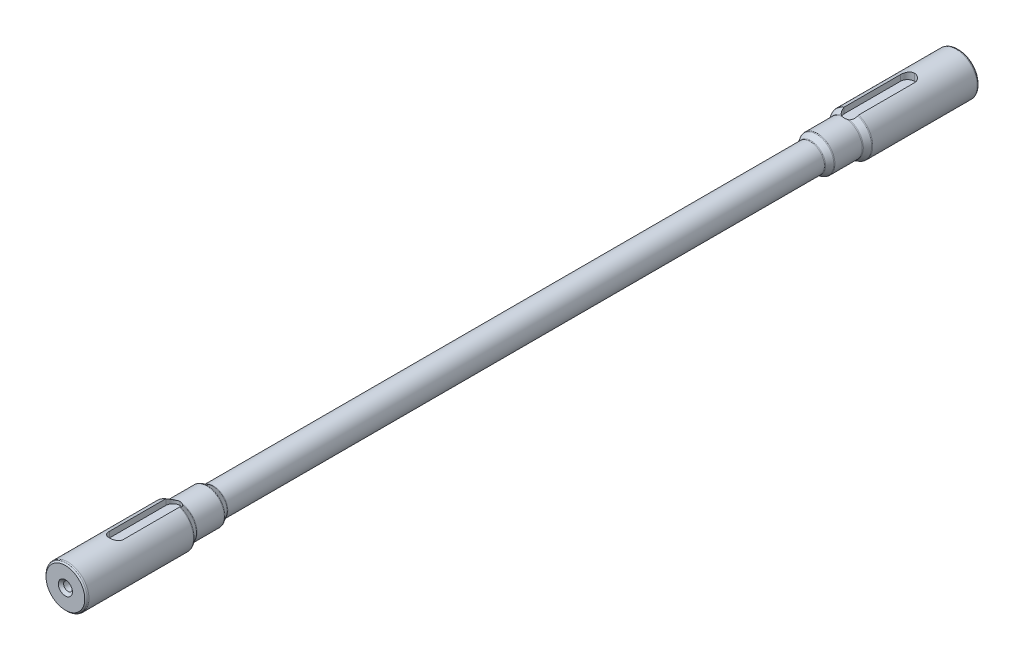
from build123d import *

# Parameters (mm, degrees)
SKETCH1_R                   = 12
BOSS_EXTRUDE1_DEPTH         = 253.5
CHAMFER1_SIZE               = 1
FILLET1_R                   = 1
SKETCH3_W                   = 40
SKETCH3_H                   = 8
CUT_EXTRUDE1_DEPTH          = 4
FILLET2_R                   = 4
M6_TAPPED_HOLE1_D           = 5
M6_TAPPED_HOLE1_DEPTH       = 17
M6_TAPPED_HOLE1_CSINK_D     = 8
M6_TAPPED_HOLE1_CSINK_ANGLE = 90
M6_TAPPED_HOLE1_TIP         = 1.502151548
M6_TAPPED_HOLE2_D           = 5
M6_TAPPED_HOLE2_DEPTH       = 17
M6_TAPPED_HOLE2_CSINK_D     = 8
M6_TAPPED_HOLE2_CSINK_ANGLE = 90
M6_TAPPED_HOLE2_TIP         = 1.502151548


with BuildPart() as part:
    # Sketch1 → Boss-Extrude1 (new, symmetric)
    with BuildSketch(Plane.XY):
        Circle(SKETCH1_R)
    extrude(amount=BOSS_EXTRUDE1_DEPTH, both=True)

    # Sketch2 → Cut-Revolve1 (revolve, cut)
    with BuildSketch(Plane(origin=(0, 0, 0), x_dir=(1, 0, 0), z_dir=(0, 1, 0)), mode=Mode.PRIVATE) as cut_revolve1_sk:
        Polygon((-10, 173.035898385), (-8, 169.57179677), (-8, -169.57179677), (-10, -173.035898385), (-10, -189.035898385), (-12, -192.5), (-12, -176.5), (-12, 176.5), (-12, 192.5), (-10, 189.035898385), align=None)
    revolve(cut_revolve1_sk.sketch.rotate(Axis((0, 0, 0), (0, 0, -1)), 180), axis=Axis((0, 0, 0), (0, 0, -1)), mode=Mode.SUBTRACT)

    # Chamfer1
    chamfer1_edges = [part.edges().sort_by_distance(p)[0] for p in [
        (-12, 0, -253.5),
        (-12, 0, 253.5),
    ]]
    chamfer(chamfer1_edges, length=CHAMFER1_SIZE)

    # Fillet1
    fillet1_edges = [part.edges().sort_by_distance(p)[0] for p in [
        (-12, 0, 252.5),
        (-12, 0, -252.5),
        (-10, 0, -189.035898385),
        (-10, 0, -173.035898385),
        (-8, 0, -169.57179677),
        (-8, 0, 169.57179677),
        (-10, 0, 173.035898385),
        (-10, 0, 189.035898385),
        (-12, 0, 192.5),
        (-12, 0, -192.5),
    ]]
    fillet(fillet1_edges, radius=FILLET1_R)

    # Sketch3 → Cut-Extrude1 (cut, symmetric)
    with BuildSketch(Plane(origin=(0, 0, 0), x_dir=(0, 0, -1), z_dir=(1, 0, 0))):
        with Locations((208.5, 12)):
            Rectangle(SKETCH3_W, SKETCH3_H)
        with Locations((-208.5, 12)):
            Rectangle(SKETCH3_W, SKETCH3_H)
    extrude(amount=CUT_EXTRUDE1_DEPTH, both=True, mode=Mode.SUBTRACT)

    # Fillet2
    fillet2_edges = [part.edges().sort_by_distance(p)[0] for p in [
        (-4, 8.582575695, 188.5),
        (4, 8.582575695, 188.5),
        (4, 9.656854249, 228.5),
        (-4, 9.656854249, 228.5),
        (-4, 8.582575695, -188.5),
        (4, 8.582575695, -188.5),
        (-4, 9.656854249, -228.5),
        (4, 9.656854249, -228.5),
    ]]
    fillet(fillet2_edges, radius=FILLET2_R - 0.0001)  # a hair under: the kernel refuses the full size

    # M6 Tapped Hole1
    with Locations(Plane(origin=(0, 0, -253.5), x_dir=(-1, 0, 0), z_dir=(0, 0, -1))):
        with Locations((0, 0)):
            CounterSinkHole(M6_TAPPED_HOLE1_D / 2, M6_TAPPED_HOLE1_CSINK_D / 2, depth=M6_TAPPED_HOLE1_DEPTH, counter_sink_angle=M6_TAPPED_HOLE1_CSINK_ANGLE)
            with Locations((0, 0, -(M6_TAPPED_HOLE1_DEPTH + M6_TAPPED_HOLE1_TIP / 2))):  # 118° drill point
                Cone(0, M6_TAPPED_HOLE1_D / 2, M6_TAPPED_HOLE1_TIP, mode=Mode.SUBTRACT)

    # M6 Tapped Hole2
    with Locations(Plane.XY.offset(253.5)):
        with Locations((0, 0)):
            CounterSinkHole(M6_TAPPED_HOLE2_D / 2, M6_TAPPED_HOLE2_CSINK_D / 2, depth=M6_TAPPED_HOLE2_DEPTH, counter_sink_angle=M6_TAPPED_HOLE2_CSINK_ANGLE)
            with Locations((0, 0, -(M6_TAPPED_HOLE2_DEPTH + M6_TAPPED_HOLE2_TIP / 2))):  # 118° drill point
                Cone(0, M6_TAPPED_HOLE2_D / 2, M6_TAPPED_HOLE2_TIP, mode=Mode.SUBTRACT)


solid = part.part
